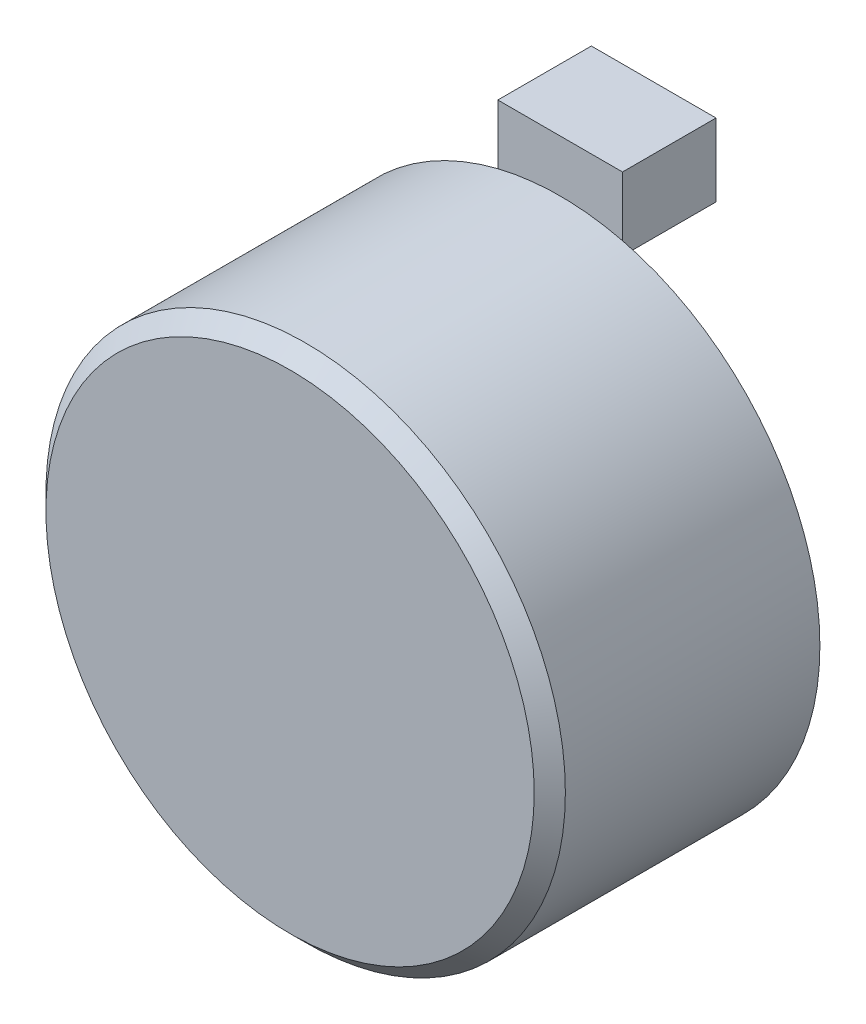
from build123d import *

# Parameters (mm, degrees)
SK_REARHOLE_R           = 1.65
REAR_TAPPED_HOLE_DEPTH  = 8
REAR_HOLE_PATTERN_COUNT = 8
SK_CONNECTOR_W          = 24
SK_CONNECTOR_H          = 14
CONNECTOR_ZONE_DEPTH    = 18


with BuildPart() as part:
    # SK_Body → Housing_Body (revolve)
    with BuildSketch(Plane(origin=(0, 0, 0), x_dir=(1, 0, 0), z_dir=(0, 1, 0))):
        Polygon((0, 0), (47, 0), (50, 3), (50, 52), (47, 52), (0, 52), align=None)
    revolve(axis=Axis((0, 0, 10), (0, 0, -1)))

    # SK_RearHole → Rear_Tapped_Hole (cut)
    with BuildSketch(Plane.XY.offset(-52)):
        with Locations((42, 0)):
            Circle(SK_REARHOLE_R)
    rear_tapped_hole = extrude(amount=REAR_TAPPED_HOLE_DEPTH, mode=Mode.SUBTRACT)

    # Rear_Hole_Pattern: Rear_Tapped_Hole ×8 about axis
    rear_hole_pattern_axis = Axis((0, 0, -73.5), (0, 0, 1))
    for i in range(1, REAR_HOLE_PATTERN_COUNT):
        add(rear_tapped_hole.rotate(rear_hole_pattern_axis, i * 360 / REAR_HOLE_PATTERN_COUNT), mode=Mode.SUBTRACT)

    # SK_Connector → Connector_Zone (add)
    with BuildSketch(Plane.XY.offset(-52)):
        with Locations((0, 53)):
            Rectangle(SK_CONNECTOR_W, SK_CONNECTOR_H)
    extrude(amount=-CONNECTOR_ZONE_DEPTH)


solid = part.part
